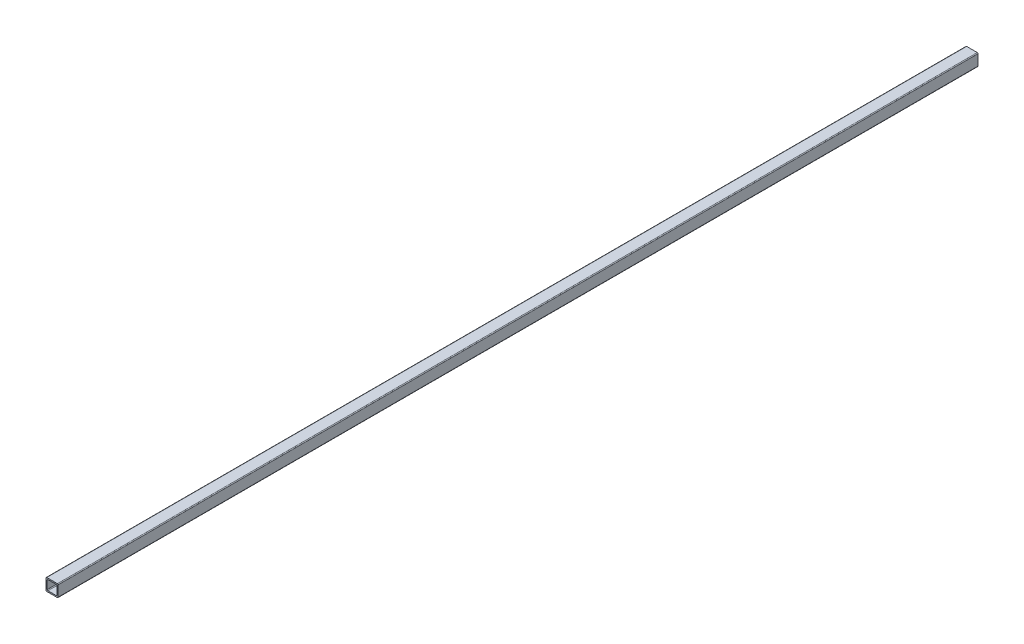
from build123d import *

# Parameters (mm, degrees)
SKETCH1_W           = 7.9
SKETCH1_H           = 7.9
SKETCH1_W_2         = 6.3
SKETCH1_H_2         = 6.3
BOSS_EXTRUDE1_DEPTH = 300
FILLET1_R           = 0.5


with BuildPart() as part:
    # Sketch1 → Boss-Extrude1 (new, symmetric)
    with BuildSketch(Plane.XY):
        Rectangle(SKETCH1_W, SKETCH1_H)
        Rectangle(SKETCH1_W_2, SKETCH1_H_2, mode=Mode.SUBTRACT)
    extrude(amount=BOSS_EXTRUDE1_DEPTH, both=True)

    # Fillet1
    fillet1_edges = [part.edges().sort_by_distance(p)[0] for p in [
        (3.95, 3.95, 0),
        (3.15, 3.15, 0),
        (3.95, -3.95, 0),
        (3.15, -3.15, 0),
        (-3.95, -3.95, 0),
        (-3.15, -3.15, 0),
        (-3.15, 3.15, 0),
        (-3.95, 3.95, 0),
    ]]
    fillet(fillet1_edges, radius=FILLET1_R)


solid = part.part
